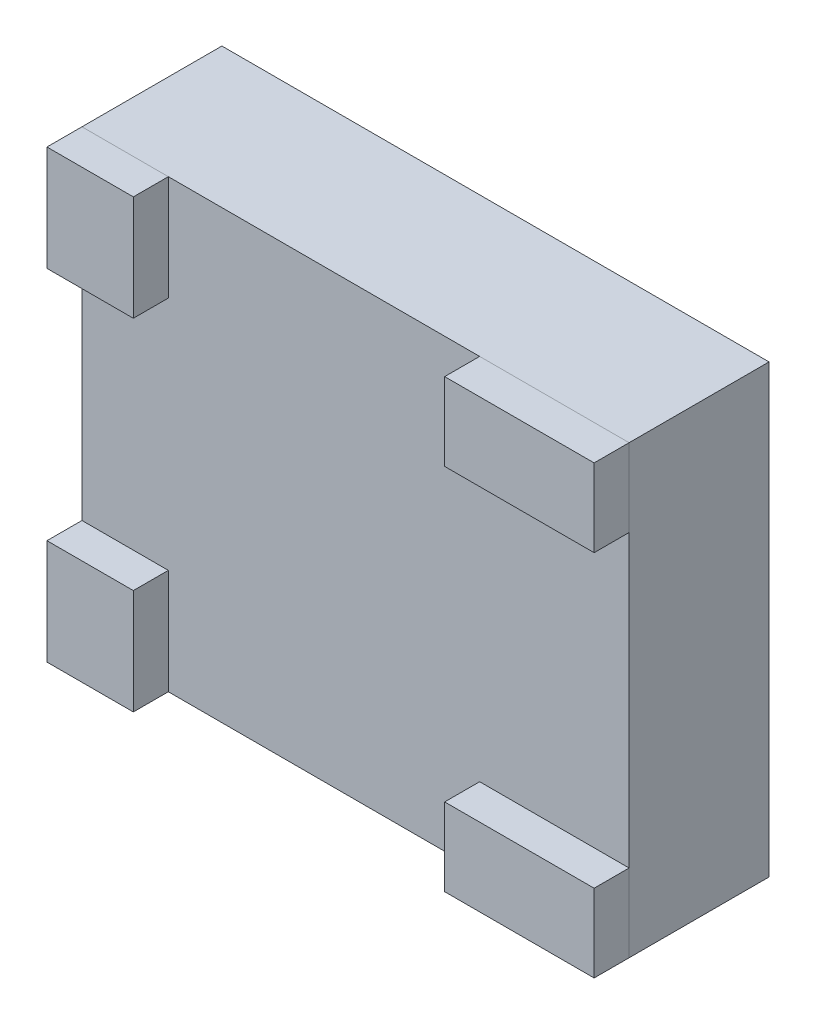
from build123d import *

# Parameters (mm, degrees)
ESBO_O1_W                  = 156.39786889
ESBO_O1_H                  = 127.51
EXTRUDE_A_DEPTH            = 40
ESBO_O2_W                  = 24.691065998
ESBO_O2_H                  = 30.055139327
RESSALTO_EXTRUS_O2_DEPTH   = 10
RESSALTO_EXTRUS_O2_2_DEPTH = 10
ESBO_O2_W_2                = 42.720162864
ESBO_O2_H_2                = 22.228889681
RESSALTO_EXTRUS_O2_3_DEPTH = 10
RESSALTO_EXTRUS_O2_4_DEPTH = 10


with BuildPart() as part:
    # Esboço1 → A (new body)
    with BuildSketch(Plane.XY):
        Rectangle(ESBO_O1_W, ESBO_O1_H)
    extrude(amount=EXTRUDE_A_DEPTH)


with BuildPart() as body_2:
    # Esboço2 → Ressalto-extrusão2 (new body)
    with BuildSketch(Plane.XY.offset(40)):
        with Locations((-65.853401446, -48.727430337)):
            Rectangle(ESBO_O2_W, ESBO_O2_H)
    extrude(amount=RESSALTO_EXTRUS_O2_DEPTH)


with BuildPart() as body_3:
    # Esboço2 → Ressalto-extrus_o2 2 (new body)
    with BuildSketch(Plane.XY.offset(40)):
        with Locations((-65.853401446, 48.727430337)):
            Rectangle(ESBO_O2_W, ESBO_O2_H)
    extrude(amount=RESSALTO_EXTRUS_O2_2_DEPTH)


with BuildPart() as body_4:
    # Esboço2 → Ressalto-extrus_o2 3 (new body)
    with BuildSketch(Plane.XY.offset(40)):
        with Locations((56.838853013, 52.64055516)):
            Rectangle(ESBO_O2_W_2, ESBO_O2_H_2)
    extrude(amount=RESSALTO_EXTRUS_O2_3_DEPTH)


with BuildPart() as body_5:
    # Esboço2 → Ressalto-extrus_o2 4 (new body)
    with BuildSketch(Plane.XY.offset(40)):
        with Locations((56.838853013, -52.64055516)):
            Rectangle(ESBO_O2_W_2, ESBO_O2_H_2)
    extrude(amount=RESSALTO_EXTRUS_O2_4_DEPTH)


solid = Compound([part.part, body_2.part, body_3.part, body_4.part, body_5.part])
